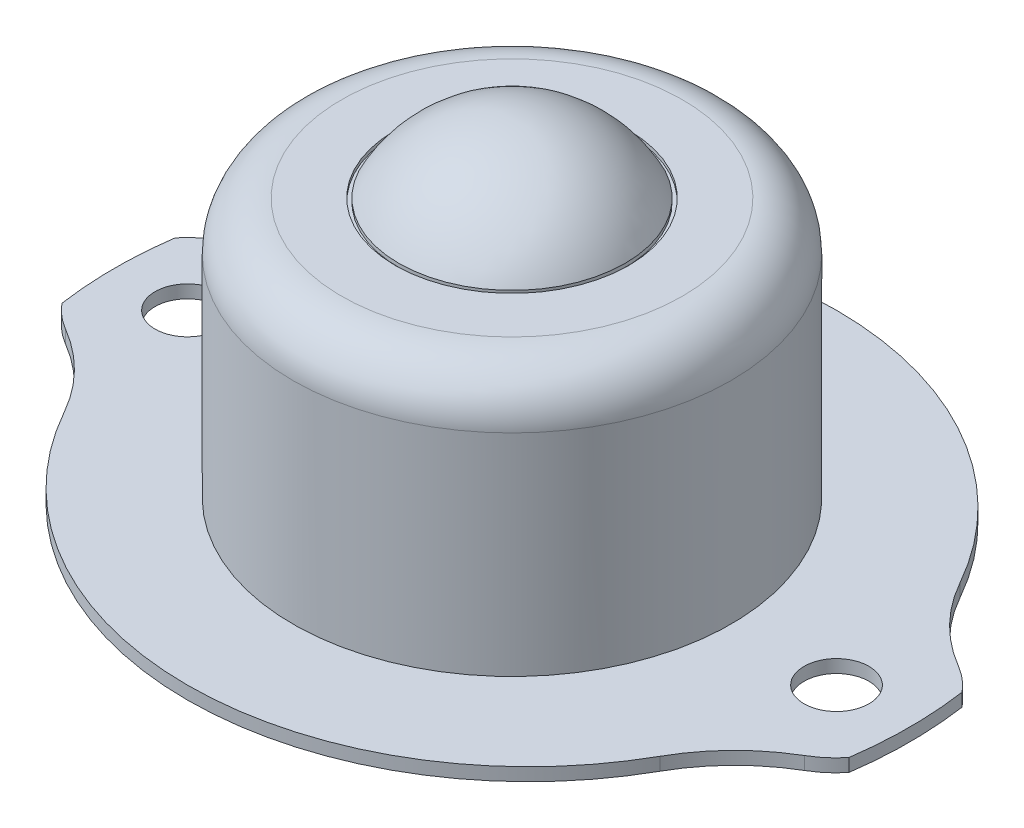
from build123d import *

# Parameters (mm, degrees)
FILLET_1_R          = 3
SKETCH_2_R          = 2
CUT_EXTRUDE_1_DEPTH = 10


with BuildPart() as part:
    # 草图1 → 旋转1 (revolve)
    with BuildSketch(Plane.XY):
        Polygon((0, -0.4), (0, 16.4), (-6.979971347, 16.4), (-6.979971347, 16.177681197), (-7.205553414, 16.177681197), (-7.205553414, 16.4), (-13.5, 16.4), (-13.5, 0.4), (-24.5, 0.4), (-24.5, -0.4), align=None)
    revolve(axis=Axis((0, 20.6, 0), (0, -1, 0)))

    # 草图1<3> → 旋转2 (revolve)
    with BuildSketch(Plane.XY):
        with BuildLine():
            Line((-6.979971347, 16.4), (0, 16.4))
            Line((0, 16.4), (0, 20.6))
            ThreePointArc((0, 20.6), (-4.073082371, 19.4690472), (-6.979971347, 16.4))
        make_face()
    revolve(axis=Axis((0, 20.6, 0), (0, -1, 0)))

    # 圆角1
    fillet_1_edges = [part.edges().sort_by_distance(p)[0] for p in [
        (13.5, 16.4, 0),
    ]]
    fillet(fillet_1_edges, radius=FILLET_1_R)

    # 草图2 → 切除-拉伸1 (cut)
    with BuildSketch(Plane.XZ.offset(0.4)):
        with Locations((-20, 0)):
            Circle(SKETCH_2_R)
        with Locations((20, 0)):
            Circle(SKETCH_2_R)
        with BuildLine():
            ThreePointArc((-24.25, -3.491060011), (0, -24.5), (24.25, -3.491060011))
            ThreePointArc((24.25, -3.491060011), (23.568060584, -4.185563721), (22.77437579, -4.748982941))
            ThreePointArc((22.77437579, -4.748982941), (20.265276607, -6.702825437), (18.357504114, -9.24712953))
            ThreePointArc((18.357504114, -9.24712953), (0, -20.006865782), (-18.357504114, -9.24712953))
            ThreePointArc((-18.357504114, -9.24712953), (-20.265276607, -6.702825437), (-22.77437579, -4.748982941))
            ThreePointArc((-22.77437579, -4.748982941), (-23.568060584, -4.185563721), (-24.25, -3.491060011))
        make_face()
        with BuildLine():
            ThreePointArc((22.77437579, 4.748982941), (23.568060584, 4.185563721), (24.25, 3.491060011))
            ThreePointArc((24.25, 3.491060011), (0, 24.5), (-24.25, 3.491060011))
            ThreePointArc((-24.25, 3.491060011), (-23.568060584, 4.185563721), (-22.77437579, 4.748982941))
            ThreePointArc((-22.77437579, 4.748982941), (-20.265276607, 6.702825437), (-18.357504114, 9.24712953))
            ThreePointArc((-18.357504114, 9.24712953), (0, 20.006865782), (18.357504114, 9.24712953))
            ThreePointArc((18.357504114, 9.24712953), (20.265276607, 6.702825437), (22.77437579, 4.748982941))
        make_face()
    extrude(amount=-CUT_EXTRUDE_1_DEPTH, mode=Mode.SUBTRACT)


solid = part.part
